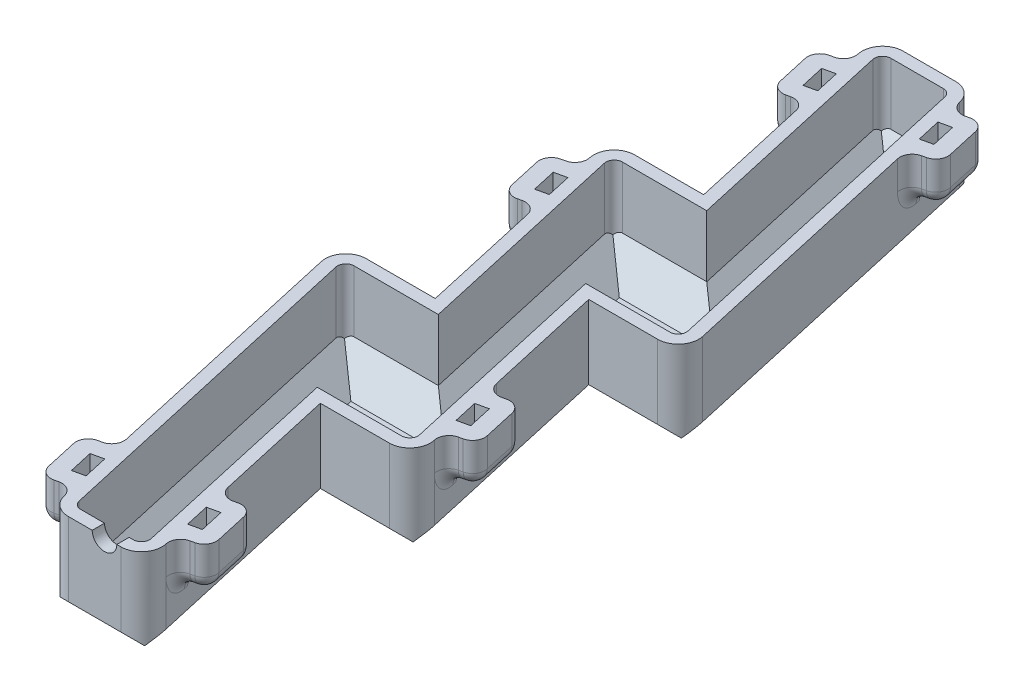
from build123d import *

# Parameters (mm, degrees)
BOSS_EXTRUDE1_DEPTH = 25
CUT_EXTRUDE1_DEPTH  = 22
CHAMFER1_SIZE       = 7
FILLET1_R           = 2
FILLET2_R           = 5
BOSS_EXTRUDE2_DEPTH = 10
FILLET3_R           = 3
SKETCH16_R          = 3
CUT_EXTRUDE2_DEPTH  = 10


with BuildPart() as part:
    # Sketch1 → Boss-Extrude1 (new body)
    with BuildSketch(Plane(origin=(0, 0, 0), x_dir=(1, 0, 0), z_dir=(0, 1, 0))):
        Polygon((-21.708735773, 45.372193924), (1.350541496, 45.372193924), (21.708735773, -45.372193924), (-1.350541496, -45.372193924), align=None)
        Polygon((32.512450848, 9.255612153), (9.453173579, 9.255612153), (-10.905020697, 100), (12.154256572, 100), align=None)
        Polygon((-32.512450848, -9.255612153), (-9.453173579, -9.255612153), (10.905020697, -100), (-12.154256572, -100), align=None)
    extrude(amount=BOSS_EXTRUDE1_DEPTH)

    # Sketch4 → Cut-Extrude1 (cut)
    with BuildSketch(Plane(origin=(0, 25, 0), x_dir=(1, 0, 0), z_dir=(0, 1, 0))):
        Polygon((-28.764840766, -12.255612153), (-9.752726049, -97), (7.157410615, -97), (-11.854704102, -12.255612153), align=None)
        Polygon((-5.098151579, -42.372193924), (1.050989026, -42.372193924), (-5.705563497, -12.255612153), (-11.854704102, -12.255612153), align=None)
        Polygon((-17.96112569, 42.372193924), (-1.050989026, 42.372193924), (17.96112569, -42.372193924), (1.050989026, -42.372193924), align=None)
        Polygon((-7.157410615, 97), (9.752726049, 97), (28.764840766, 12.255612153), (11.854704102, 12.255612153), align=None)
        Polygon((-1.050989026, 42.372193924), (5.705563497, 12.255612153), (11.854704102, 12.255612153), (5.098151579, 42.372193924), align=None)
    extrude(amount=-CUT_EXTRUDE1_DEPTH, mode=Mode.SUBTRACT)

    # Chamfer1
    chamfer1_edges = [part.edges().sort_by_distance(p)[0] for p in [
        (20.982812214, 0, -9.255612153),
        (15.580954676, 0, 18.058290886),
        (10.179097138, 0, 45.372193924),
        (4.7772396, 0, 72.686096962),
        (-0.624617937, 0, 100),
        (-22.33335371, 0, 54.627806076),
        (-20.982812214, 0, 9.255612153),
        (-15.580954676, 0, -18.058290886),
        (-10.179097138, 0, -45.372193924),
        (-4.7772396, 0, -72.686096962),
        (0.624617937, 0, -100),
        (22.33335371, 0, -54.627806076),
        (-19.258783408, 3, 54.627806076),
        (19.258783408, 3, -54.627806076),
        (11.833344593, 3, 15.058290886),
        (-1.297657717, 3, 97),
        (-17.235202131, 3, 12.255612153),
        (-11.833344593, 3, -15.058290886),
        (-6.431487056, 3, -42.372193924),
        (-1.029629518, 3, -69.686096962),
        (1.297657717, 3, -97),
        (17.235202131, 3, -12.255612153),
        (6.431487056, 3, 42.372193924),
        (1.029629518, 3, 69.686096962),
    ]]
    chamfer(chamfer1_edges, length=CHAMFER1_SIZE)

    # Fillet1
    fillet1_edges = [part.edges().sort_by_distance(p)[0] for p in [
        (-28.764840766, 17.5, 12.255612153),
        (-17.96112569, 17.5, -42.372193924),
        (-7.157410615, 17.5, -97),
        (9.752726049, 17.5, -97),
        (28.764840766, 17.5, -12.255612153),
        (17.96112569, 17.5, 42.372193924),
        (7.157410615, 17.5, 97),
        (-9.752726049, 17.5, 97),
    ]]
    fillet(fillet1_edges, radius=FILLET1_R)

    # Fillet2
    fillet2_edges = [part.edges().sort_by_distance(p)[0] for p in [
        (32.512450848, 16, -9.255612153),
        (21.708735773, 16, 45.372193924),
        (10.905020697, 16, 100),
        (-12.154256572, 16, 100),
        (-32.512450848, 16, 9.255612153),
        (-21.708735773, 16, -45.372193924),
        (-10.905020697, 16, -100),
        (12.154256572, 16, -100),
    ]]
    fillet(fillet2_edges, radius=FILLET2_R)

    # Sketch14 → Boss-Extrude2 (add)
    with BuildSketch(Plane(origin=(0, 25, 0), x_dir=(1, 0, 0), z_dir=(0, 1, 0))):
        Polygon((-15.711241219, 89.445897905), (-8.881018478, 90.978235108), (-8.005397219, 87.075250685), (-10.932635537, 86.41853474), (-9.619203648, 80.564058105), (-6.69196533, 81.220774049), (-5.816344071, 77.317789626), (-12.646566812, 75.785452422), align=None)
        Polygon((13.687152175, 93.167288256), (14.562773434, 89.264303833), (17.490011752, 89.921019777), (18.80344364, 84.066543142), (15.876205323, 83.409827197), (16.751826582, 79.506842774), (23.582049323, 81.039179978), (20.517374916, 94.69962546), align=None)
        Polygon((-19.684733554, 36.350429032), (-18.809112294, 32.447444609), (-21.736350612, 31.790728664), (-20.422918723, 25.936252029), (-17.495680406, 26.592967973), (-16.620059146, 22.68998355), (-23.450281888, 21.157646346), (-26.514956295, 34.818091828), align=None)
        Polygon((19.684733554, -36.350429032), (18.809112294, -32.447444609), (21.736350612, -31.790728664), (20.422918723, -25.936252029), (17.495680406, -26.592967973), (16.620059146, -22.68998355), (23.450281888, -21.157646346), (26.514956295, -34.818091828), align=None)
        Polygon((-13.687152175, -93.167288256), (-14.562773434, -89.264303833), (-17.490011752, -89.921019777), (-18.80344364, -84.066543142), (-15.876205323, -83.409827197), (-16.751826582, -79.506842774), (-23.582049323, -81.039179978), (-20.517374916, -94.69962546), align=None)
        Polygon((8.881018478, -90.978235108), (8.005397219, -87.075250685), (10.932635537, -86.41853474), (9.619203648, -80.564058105), (6.69196533, -81.220774049), (5.816344071, -77.317789626), (12.646566812, -75.785452422), (15.711241219, -89.445897905), align=None)
    extrude(amount=-BOSS_EXTRUDE2_DEPTH)

    # Fillet3
    fillet3_edges = [part.edges().sort_by_distance(p)[0] for p in [
        (12.646566812, 20, 75.785452422),
        (9.231455441, 15, 76.551621024),
        (15.711241219, 20, 89.445897905),
        (14.178904016, 15, 82.615675164),
        (12.296129849, 15, 90.212066507),
        (23.450281888, 20, 21.157646346),
        (20.035170517, 15, 21.923814948),
        (24.982619091, 15, 27.987869087),
        (26.514956295, 20, 34.818091828),
        (23.099844924, 15, 35.58426043),
        (23.582049323, 20, -81.039179978),
        (20.517374916, 20, -94.69962546),
        (17.102263545, 15, -93.933456858),
        (22.04971212, 15, -87.869402719),
        (20.166937953, 15, -80.273011376),
        (-12.296129849, 15, -90.212066507),
        (-15.711241219, 20, -89.445897905),
        (-14.178904016, 15, -82.615675164),
        (-12.646566812, 20, -75.785452422),
        (-9.231455441, 15, -76.551621024),
        (-23.099844924, 15, -35.58426043),
        (-26.514956295, 20, -34.818091828),
        (-24.982619091, 15, -27.987869087),
        (-23.450281888, 20, -21.157646346),
        (-20.035170517, 15, -21.923814948),
        (-20.166937953, 15, 80.273011376),
        (-23.582049323, 20, 81.039179978),
        (-20.517374916, 20, 94.69962546),
        (-22.04971212, 15, 87.869402719),
        (-17.102263545, 15, 93.933456858),
    ]]
    fillet(fillet3_edges, radius=FILLET3_R)
    fillet3_2_edges = [part.edges().sort_by_distance(p)[0] for p in [
        (5.816344071, 21.5, 77.317789626),
        (8.881018478, 21.5, 90.978235108),
        (16.620059146, 21.5, 22.68998355),
        (19.684733554, 21.5, 36.350429032),
        (13.687152175, 21.5, -93.167288256),
        (16.751826582, 21.5, -79.506842774),
        (-8.881018478, 21.5, -90.978235108),
        (-5.816344071, 21.5, -77.317789626),
        (-18.918564952, 15, -32.935317661),
        (-17.386227748, 15, -26.10509492),
        (-15.98565798, 15, 82.921954145),
        (-14.453320777, 15, 89.752176886),
        (6.582512673, 15, 80.732900997),
        (8.114849876, 15, 87.563123738),
        (17.386227748, 15, 26.10509492),
        (18.918564952, 15, 32.935317661),
        (14.453320777, 15, -89.752176886),
        (15.98565798, 15, -82.921954145),
        (-8.114849876, 15, -87.563123738),
        (-6.582512673, 15, -80.732900997),
        (-19.684733554, 21.5, -36.350429032),
        (-16.620059146, 21.5, -22.68998355),
        (-16.751826582, 21.5, 79.506842774),
        (-13.687152175, 21.5, 93.167288256),
        (-13.879499822, 15.878679656, 92.309920003),
        (-16.559478935, 15.878679656, 80.364211027),
        (-16.812406793, 15.878679656, -23.547351803),
        (-19.492385907, 15.878679656, -35.493060779),
        (-6.008691718, 15.878679656, -78.175157879),
        (-8.688670831, 15.878679656, -90.120866855),
        (16.559478935, 15.878679656, -80.364211027),
        (13.879499822, 15.878679656, -92.309920003),
        (19.492385907, 15.878679656, 35.493060779),
        (16.812406793, 15.878679656, 23.547351803),
        (8.688670831, 15.878679656, 90.120866855),
        (6.008691718, 15.878679656, 78.175157879),
    ]]
    fillet(fillet3_2_edges, radius=FILLET3_R - 0.0001)  # a hair under: the kernel refuses the full size

    # Sketch16 → Cut-Extrude2 (cut)
    with BuildSketch(Plane.XY.offset(100)):
        with Locations((0.659003893, 25)):
            Circle(SKETCH16_R)
    extrude(amount=-CUT_EXTRUDE2_DEPTH, mode=Mode.SUBTRACT)


solid = part.part
